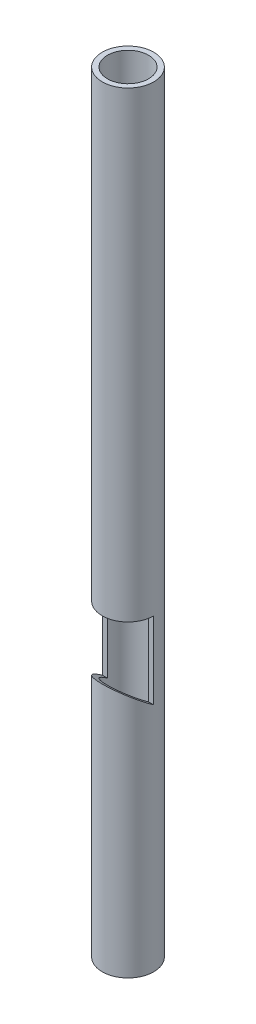
from build123d import *

# Parameters (mm, degrees)
SKETCH1_R                           = 16.7
SKETCH1_R_2                         = 13.32
EXTRUDE1_DEPTH                      = 500
CUT_EXTRUDE1_REACH                  = 502.557
CUT_EXTRUDE1_END_RADIUS             = 16.7
CUT_EXTRUDE1_DIRECTION_2_REACH      = 502.557
CUT_EXTRUDE1_DIRECTION_2_END_RADIUS = 16.7


with BuildPart() as part:
    # Sketch1 → Extrude1 (new body)
    with BuildSketch(Plane(origin=(0, 0, 0), x_dir=(1, 0, 0), z_dir=(0, 1, 0))):
        Circle(SKETCH1_R)
        Circle(SKETCH1_R_2, mode=Mode.SUBTRACT)
    extrude(amount=EXTRUDE1_DEPTH)

    # Cut-Extrude1: up to this cylinder (the profile starts inside it)
    cut_extrude1_end = Plane(origin=(0, 178.310993, 0), z_dir=(0, -1, 0)) * Cylinder(CUT_EXTRUDE1_END_RADIUS, 1039.514, mode=Mode.PRIVATE)
    # Sketch2 → Cut-Extrude1 (cut, up to the surface)
    with BuildSketch(Plane(origin=(0, 0, 0), x_dir=(0, 0, -1), z_dir=(1, 0, 0)), mode=Mode.PRIVATE) as cut_extrude1_sk1:
        Polygon((-20, 200), (0, 200), (0, 150), (-20, 164.004150764), align=None)
    cut_extrude1_tool1 = extrude(cut_extrude1_sk1.sketch, amount=-CUT_EXTRUDE1_REACH, mode=Mode.PRIVATE) & cut_extrude1_end
    add(cut_extrude1_tool1.solids().sort_by_distance((0, 178.310993, 9.457177))[0], mode=Mode.SUBTRACT)

    # Cut-Extrude1 direction 2: up to this cylinder (the profile starts inside it)
    cut_extrude1_direction_2_end = Plane(origin=(0, 178.310993, 0), z_dir=(0, -1, 0)) * Cylinder(CUT_EXTRUDE1_DIRECTION_2_END_RADIUS, 1039.514, mode=Mode.PRIVATE)
    # Sketch2 → Cut-Extrude1 direction 2 (cut, up to the surface)
    with BuildSketch(Plane(origin=(0, 0, 0), x_dir=(0, 0, -1), z_dir=(1, 0, 0)), mode=Mode.PRIVATE) as cut_extrude1_direction_2_sk1:
        Polygon((-20, 200), (0, 200), (0, 150), (-20, 164.004150764), align=None)
    cut_extrude1_direction_2_tool1 = extrude(cut_extrude1_direction_2_sk1.sketch, amount=CUT_EXTRUDE1_DIRECTION_2_REACH, mode=Mode.PRIVATE) & cut_extrude1_direction_2_end
    add(cut_extrude1_direction_2_tool1.solids().sort_by_distance((0, 178.310993, 9.457177))[0], mode=Mode.SUBTRACT)


solid = part.part
